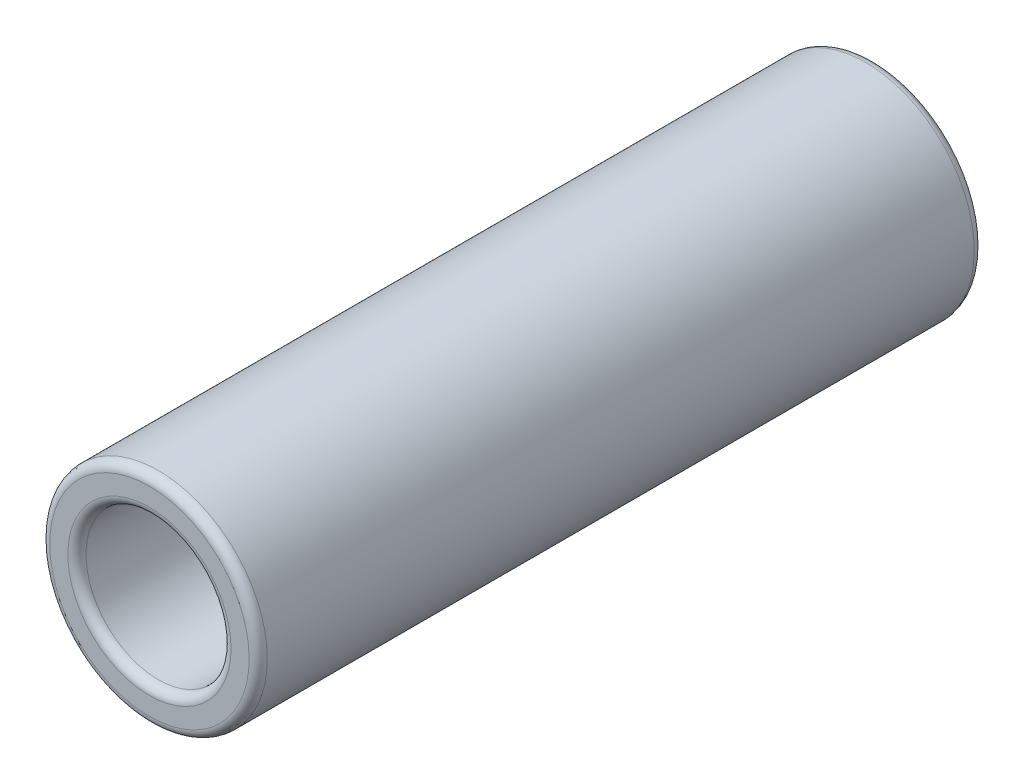
from build123d import *

# Parameters (mm, degrees)
SKETCH1_R           = 6
SKETCH1_R_2         = 4
BOSS_EXTRUDE1_DEPTH = 20
FILLET1_R           = 0.5


with BuildPart() as part:
    # Sketch1 → Boss-Extrude1 (new, symmetric)
    with BuildSketch(Plane.XY):
        Circle(SKETCH1_R)
        Circle(SKETCH1_R_2, mode=Mode.SUBTRACT)
    extrude(amount=BOSS_EXTRUDE1_DEPTH, both=True)

    # Fillet1
    fillet1_edges = [part.edges().sort_by_distance(p)[0] for p in [
        (-4, 0, -20),
        (-4, 0, 20),
        (-6, 0, -20),
        (-6, 0, 20),
    ]]
    fillet(fillet1_edges, radius=FILLET1_R)


solid = part.part
